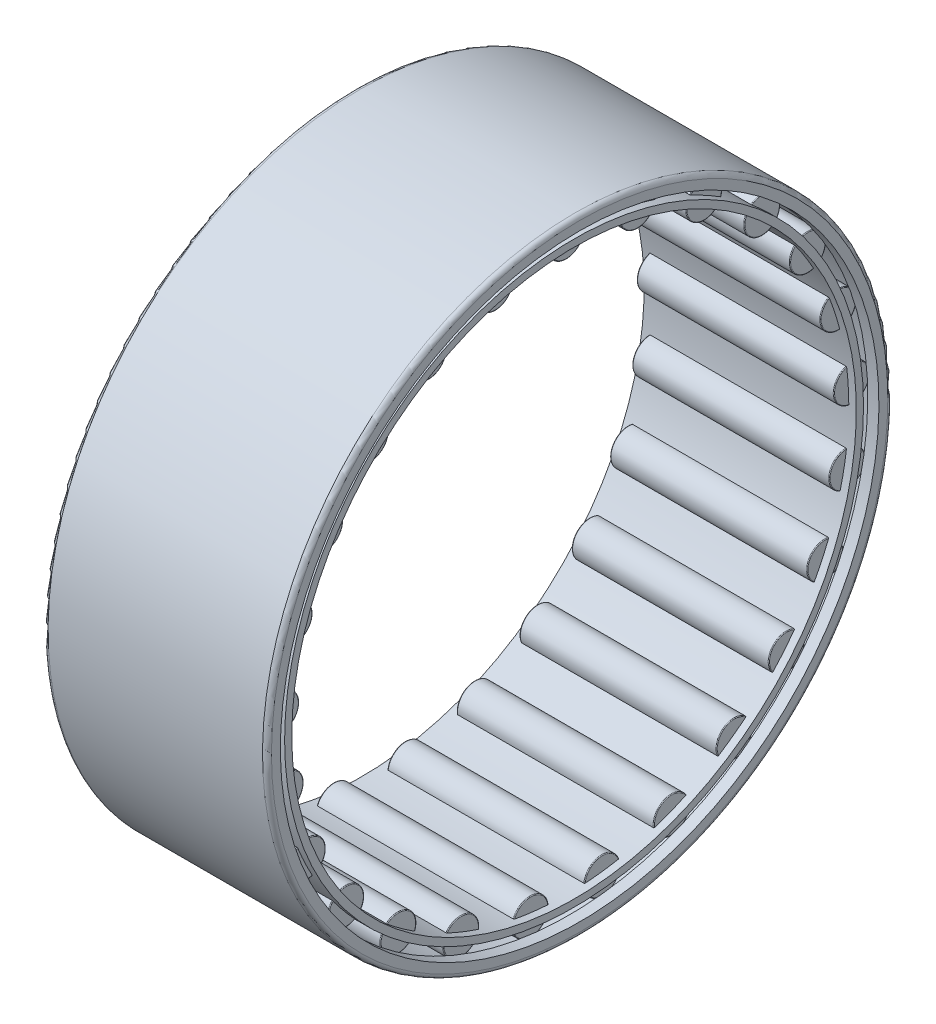
from build123d import *

# Parameters (mm, degrees)
CAGSPISKE_W           = 30.1625
CAGSPISKE_H           = 1.0162
ROLLERSDETAILED_COUNT = 25
ROLLERSDETAILED_ANGLE = 345.6


with BuildPart() as part:
    # InnRacSke → Race (revolve)
    with BuildSketch(Plane.XY):
        with BuildLine():
            Line((-14.2875, 42.545), (-15.875, 42.545))
            Line((-15.875, 42.545), (-15.875, 43.815))
            ThreePointArc((-15.875, 43.815), (-15.689012806, 44.264012806), (-15.24, 44.45))
            Line((-15.24, 44.45), (15.24, 44.45))
            ThreePointArc((15.24, 44.45), (15.689012806, 44.264012806), (15.875, 43.815))
            Line((15.875, 43.815), (15.875, 42.545))
            Line((15.875, 42.545), (14.2875, 42.545))
            Line((14.2875, 42.545), (14.2875, 43.18))
            Line((14.2875, 43.18), (-14.2875, 43.18))
            Line((-14.2875, 43.18), (-14.2875, 42.545))
        make_face()
    revolve(axis=Axis((-31.75, 0, 0), (1, 0, 0)))

    # RolDetSke → RollerDetailed (revolve)
    with BuildSketch(Plane.XY):
        with BuildLine():
            Line((-14.00175, 43.07888), (-14.00175, 40.64))
            Line((-14.00175, 40.64), (14.00175, 40.64))
            Line((14.00175, 40.64), (14.00175, 43.07888))
            ThreePointArc((14.00175, 43.07888), (13.971986191, 43.150736191), (13.90013, 43.1805))
            Line((13.90013, 43.1805), (-13.90013, 43.1805))
            ThreePointArc((-13.90013, 43.1805), (-13.971986191, 43.150736191), (-14.00175, 43.07888))
        make_face()
    rollerdetailed = revolve(axis=Axis((-28.575, 40.64, 0), (1, 0, 0)))

    # CagSpiSke → CageSpine (revolve)
    with BuildSketch(Plane.XY):
        with Locations((0, 40.64)):
            Rectangle(CAGSPISKE_W, CAGSPISKE_H)
    revolve(axis=Axis((-31.75, 0, 0), (1, 0, 0)))

    # RollersDetailed: RollerDetailed ×25 about axis
    rollersdetailed_axis = Axis((-50, 0, 0), (1, 0, 0))
    for i in range(1, ROLLERSDETAILED_COUNT):
        add(rollerdetailed.rotate(rollersdetailed_axis, i * ROLLERSDETAILED_ANGLE / (ROLLERSDETAILED_COUNT - 1)))


solid = part.part
